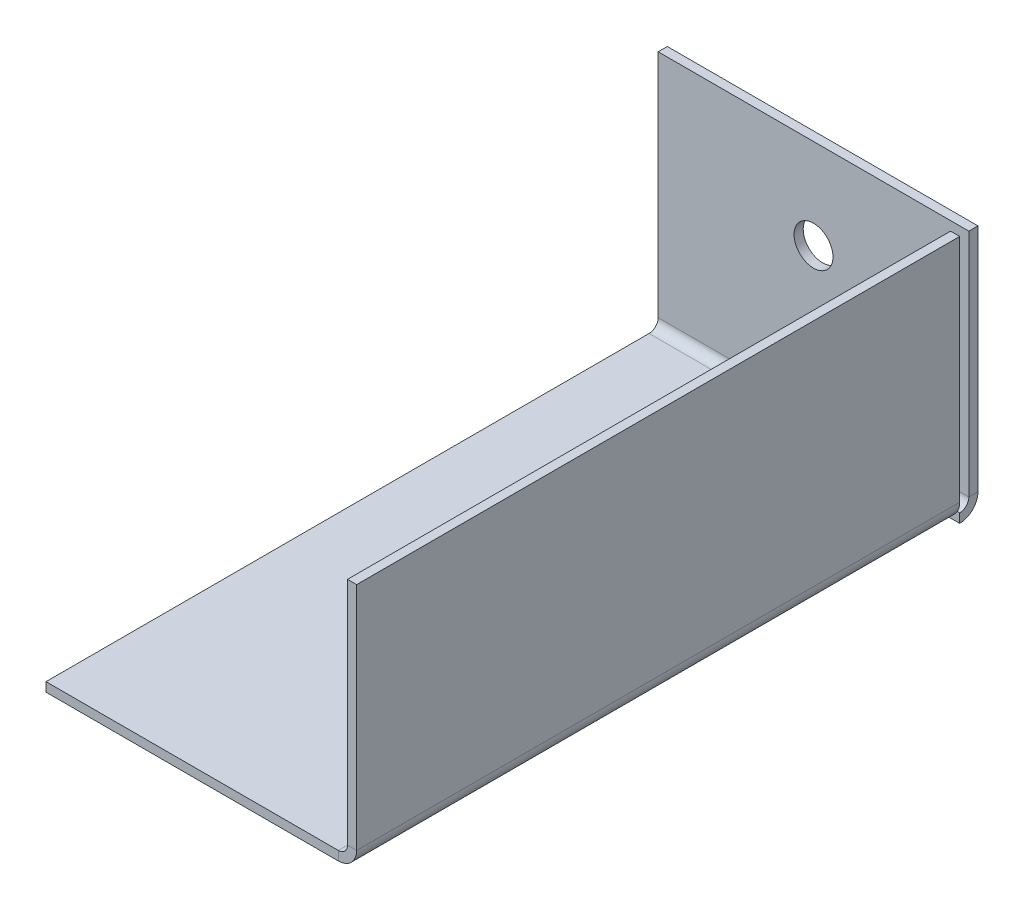
from build123d import *

# Parameters (mm, degrees)
SKETCH1_W                    = 25
SKETCH1_H                    = 50
BASE_FLANGE1_DEPTH           = 0.7366
EDGE_FLANGE1_STRIP_W         = 4.4196
EDGE_FLANGE1_STRIP_H         = 0.7366
EDGE_FLANGE1_STRIP_CUT_DEPTH = 25
EDGE_FLANGE1_DEPTH           = 25
EDGE_FLANGE1_PROFILE_W       = 25
EDGE_FLANGE1_PROFILE_H       = 18.5268
EDGE_FLANGE1_PROFILE_R       = 1.565
EDGE_FLANGE1_FLAT_DEPTH      = 0.7366
EDGE_FLANGE3_STRIP_W         = 4.4196
EDGE_FLANGE3_STRIP_H         = 0.7366
EDGE_FLANGE3_STRIP_CUT_DEPTH = 48.5268
EDGE_FLANGE3_DEPTH           = 48.5268


# Sheet-metal steps are written as plain solids
with BuildPart() as part:
    # Sketch1 → Base-Flange1 (new body)
    with BuildSketch(Plane(origin=(0, 0, 0), x_dir=(1, 0, 0), z_dir=(0, 1, 0))):
        Rectangle(SKETCH1_W, SKETCH1_H)
    extrude(amount=-BASE_FLANGE1_DEPTH)

    # Edge-Flange1 strip (across the edge) → Edge-Flange1 strip cut (cut)
    with BuildSketch(Plane(origin=(12.5, 0, -25), x_dir=(0, 0, 1), z_dir=(-1, 0, 0))):
        with Locations((-0.7366, -0.3683)):
            Rectangle(EDGE_FLANGE1_STRIP_W, EDGE_FLANGE1_STRIP_H)
    extrude(amount=EDGE_FLANGE1_STRIP_CUT_DEPTH, mode=Mode.SUBTRACT)

    # Edge-Flange1 bend section (across the edge) → Edge-Flange1 (add)
    with BuildSketch(Plane(origin=(12.5, 0, -25), x_dir=(0, 0, 1), z_dir=(-1, 0, 0))):
        with BuildLine():
            Line((0, 0.7366), (0.7366, 0.7366))
            ThreePointArc((0.7366, 0.7366), (0.952345145, 0.215745145), (1.4732, 0))
            Line((1.4732, 0), (1.4732, -0.7366))
            ThreePointArc((1.4732, -0.7366), (0.43149029, -0.30510971), (0, 0.7366))
        make_face()
    extrude(amount=EDGE_FLANGE1_DEPTH)

    # Edge-Flange1 profile (on flange) → Edge-Flange1 flat (add)
    with BuildSketch(Plane(origin=(0, 0, -25), x_dir=(-1, 0, 0), z_dir=(0, 0, -1))):
        with Locations((0, 10)):
            Rectangle(EDGE_FLANGE1_PROFILE_W, EDGE_FLANGE1_PROFILE_H)
        with Locations((0, 12)):
            Circle(EDGE_FLANGE1_PROFILE_R, mode=Mode.SUBTRACT)
    extrude(amount=-EDGE_FLANGE1_FLAT_DEPTH)

    # Edge-Flange3 strip (across the edge) → Edge-Flange3 strip cut (cut)
    with BuildSketch(Plane(origin=(12.5, 0, 25), x_dir=(-1, 0, 0), z_dir=(0, 0, -1))):
        with Locations((-0.7366, -0.3683)):
            Rectangle(EDGE_FLANGE3_STRIP_W, EDGE_FLANGE3_STRIP_H)
    extrude(amount=EDGE_FLANGE3_STRIP_CUT_DEPTH, mode=Mode.SUBTRACT)

    # Edge-Flange3 section (across the edge) → Edge-Flange3 (add)
    with BuildSketch(Plane(origin=(12.5, 0, 25), x_dir=(-1, 0, 0), z_dir=(0, 0, -1))):
        with BuildLine():
            Line((0, 0.7366), (0, 19.2634))
            Line((0, 19.2634), (0.7366, 19.2634))
            Line((0.7366, 19.2634), (0.7366, 0.7366))
            ThreePointArc((0.7366, 0.7366), (0.952345145, 0.215745145), (1.4732, 0))
            Line((1.4732, 0), (1.4732, -0.7366))
            ThreePointArc((1.4732, -0.7366), (0.43149029, -0.30510971), (0, 0.7366))
        make_face()
    extrude(amount=EDGE_FLANGE3_DEPTH)


solid = part.part
